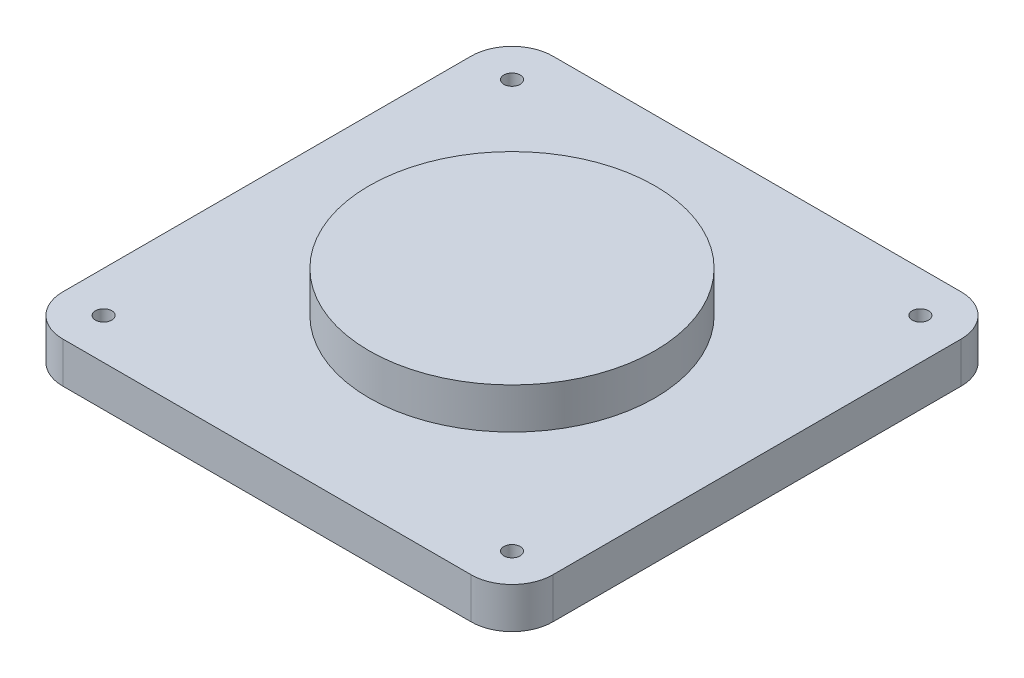
from build123d import *

# Parameters (mm, degrees)
SKETCH_1_R      = 2
EXTRUDE_1_DEPTH = 10
SKETCH_2_R      = 35
EXTRUDE_2_DEPTH = 10


with BuildPart() as part:
    # 草图1 → 凸台-拉伸1 (new body)
    with BuildSketch(Plane(origin=(0, 0, 0), x_dir=(1, 0, 0), z_dir=(0, 1, 0))):
        with BuildLine():
            Line((-50, 60), (50, 60))
            ThreePointArc((50, 60), (57.071067812, 57.071067812), (60, 50))
            Line((60, 50), (60, -50))
            ThreePointArc((60, -50), (57.071067812, -57.071067812), (50, -60))
            Line((50, -60), (-50, -60))
            ThreePointArc((-50, -60), (-57.071067812, -57.071067812), (-60, -50))
            Line((-60, -50), (-60, 50))
            ThreePointArc((-60, 50), (-57.071067812, 57.071067812), (-50, 60))
        make_face()
        with Locations((-50, 50)):
            Circle(SKETCH_1_R, mode=Mode.SUBTRACT)
        with Locations((-50, -50)):
            Circle(SKETCH_1_R, mode=Mode.SUBTRACT)
        with Locations((50, 50)):
            Circle(SKETCH_1_R, mode=Mode.SUBTRACT)
        with Locations((50, -50)):
            Circle(SKETCH_1_R, mode=Mode.SUBTRACT)
    extrude(amount=EXTRUDE_1_DEPTH)

    # 草图2 → 凸台-拉伸2 (add)
    with BuildSketch(Plane(origin=(0, 10, 0), x_dir=(1, 0, 0), z_dir=(0, 1, 0))):
        Circle(SKETCH_2_R)
    extrude(amount=EXTRUDE_2_DEPTH)


solid = part.part
